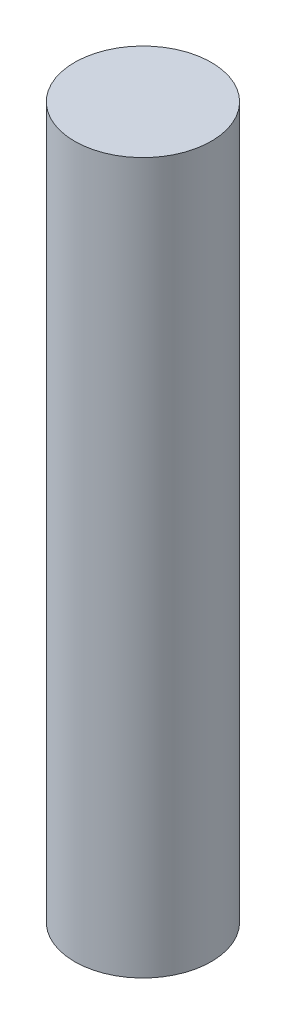
from build123d import *

# Parameters (mm, degrees)
ESQUISSE1_R        = 3.175
BOSS_EXTRU_1_DEPTH = 16.5


with BuildPart() as part:
    # Esquisse1 → Boss.-Extru.1 (new, symmetric)
    with BuildSketch(Plane(origin=(0, 0, 0), x_dir=(1, 0, 0), z_dir=(0, 1, 0))):
        Circle(ESQUISSE1_R)
    extrude(amount=BOSS_EXTRU_1_DEPTH, both=True)


solid = part.part
